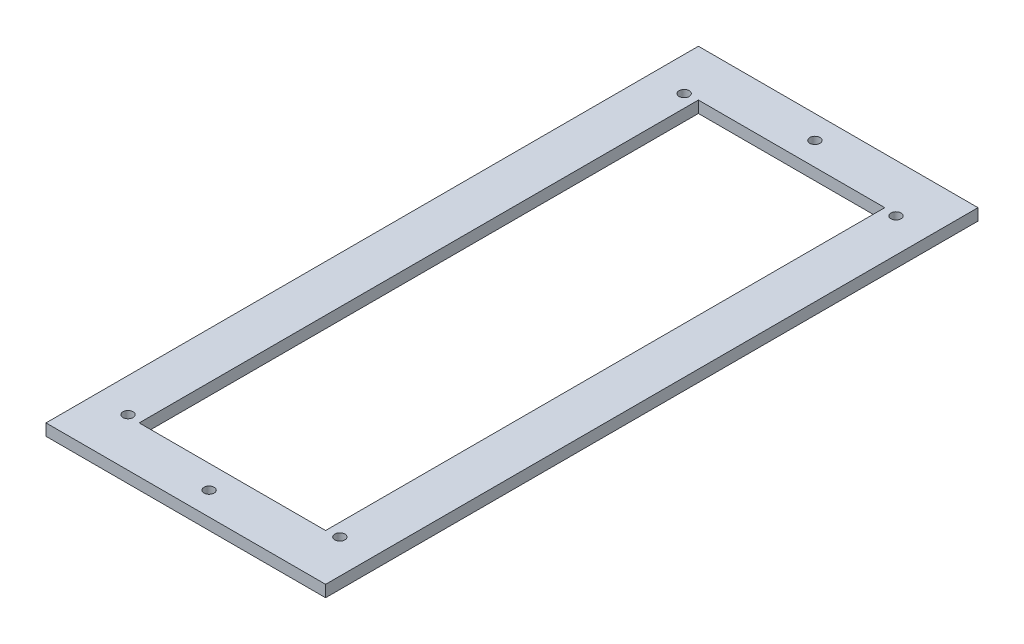
from build123d import *

# Parameters (mm, degrees)
SKETCH1_W           = 76.2
SKETCH1_H           = 177.8
BOSS_EXTRUDE1_DEPTH = 3.175
SKETCH2_R           = 1.3843
SKETCH2_W           = 50.8
SKETCH2_H           = 152.4
CUT_EXTRUDE1_DEPTH  = 182.864044344


with BuildPart() as part:
    # Sketch1 → Boss-Extrude1 (new body)
    with BuildSketch(Plane(origin=(0, 0, 0), x_dir=(1, 0, 0), z_dir=(0, 1, 0))):
        with Locations((0, -88.9)):
            Rectangle(SKETCH1_W, SKETCH1_H)
    extrude(amount=BOSS_EXTRUDE1_DEPTH)

    # Sketch2 → Cut-Extrude1 (cut, through all)
    with BuildSketch(Plane(origin=(0, 3.175, 0), x_dir=(1, 0, 0), z_dir=(0, 1, 0))):
        with Locations((0, -6.35)):
            Circle(SKETCH2_R)
        with Locations((0, -171.45)):
            Circle(SKETCH2_R)
        with Locations((-28.8671, -13.1191)):
            Circle(SKETCH2_R)
        with Locations((28.8671, -13.1191)):
            Circle(SKETCH2_R)
        with Locations((-28.8671, -164.6809)):
            Circle(SKETCH2_R)
        with Locations((28.8671, -164.6809)):
            Circle(SKETCH2_R)
        with Locations((0, -88.9)):
            Rectangle(SKETCH2_W, SKETCH2_H)
    extrude(amount=-CUT_EXTRUDE1_DEPTH, mode=Mode.SUBTRACT)


solid = part.part
